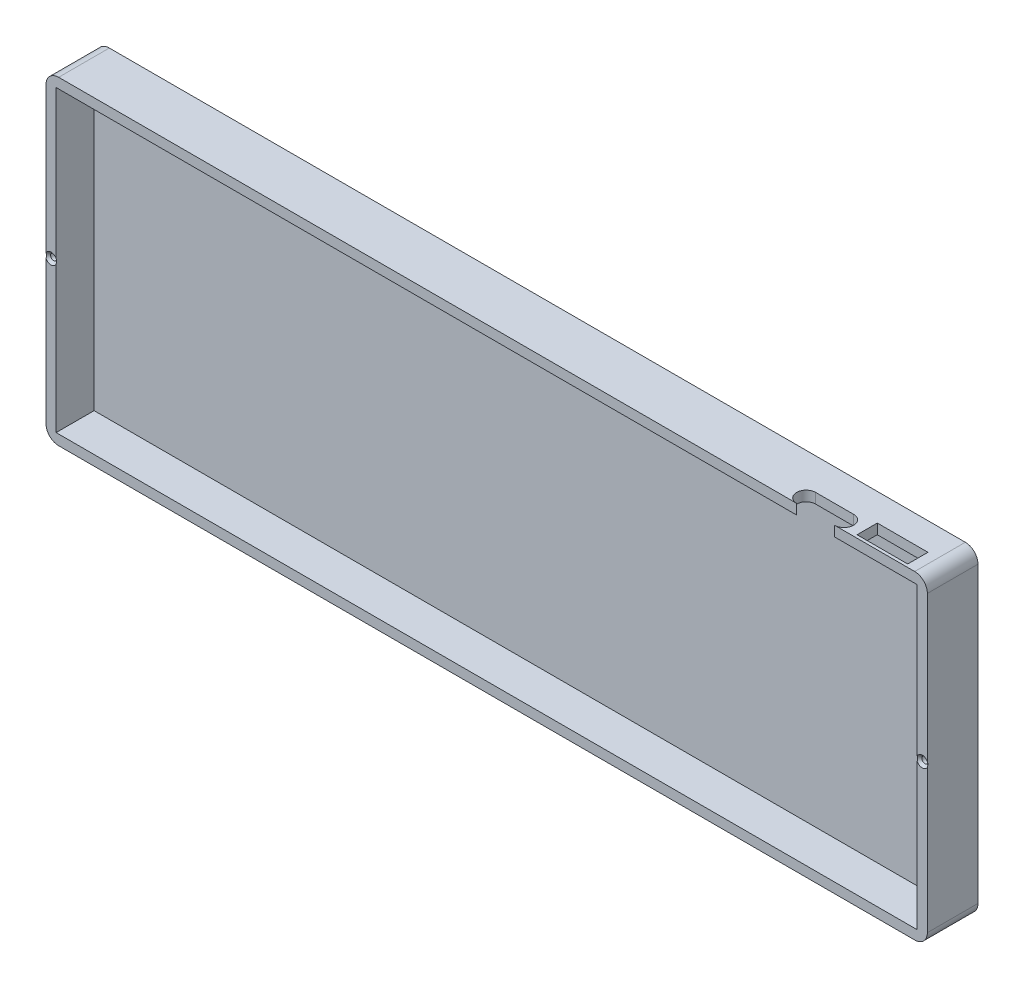
from build123d import *

# Parameters (mm, degrees)
SKETCH1_W                                       = 348
SKETCH1_H                                       = 126
BOSS_EXTRUDE1_DEPTH                             = 20
SKETCH2_W                                       = 340
SKETCH2_H                                       = 118
CUT_EXTRUDE1_DEPTH                              = 15
CUT_EXTRUDE2_REACH                              = 217.759
CUT_EXTRUDE3_REACH                              = 217.759
SKETCH5_W                                       = 20
SKETCH5_H                                       = 8
FILLET1_R                                       = 5
CSK_FOR_M2_FLAT_HEAD_MACHINE_SCREW2_D           = 2.4
CSK_FOR_M2_FLAT_HEAD_MACHINE_SCREW2_DEPTH       = 17.278967257
CSK_FOR_M2_FLAT_HEAD_MACHINE_SCREW2_CSINK_D     = 4.4
CSK_FOR_M2_FLAT_HEAD_MACHINE_SCREW2_CSINK_ANGLE = 90
CSK_FOR_M2_FLAT_HEAD_MACHINE_SCREW2_TIP         = 0.721032743


with BuildPart() as part:
    # Sketch1 → Boss-Extrude1 (new body)
    with BuildSketch(Plane.XY):
        Rectangle(SKETCH1_W, SKETCH1_H)
    extrude(amount=BOSS_EXTRUDE1_DEPTH)

    # Sketch2 → Cut-Extrude1 (cut)
    with BuildSketch(Plane.XY.offset(20)):
        Rectangle(SKETCH2_W, SKETCH2_H)
    extrude(amount=-CUT_EXTRUDE1_DEPTH, mode=Mode.SUBTRACT)

    # Sketch4 → Cut-Extrude2 (cut, up to next)
    with BuildSketch(Plane(origin=(0, 63, 0), x_dir=(1, 0, 0), z_dir=(0, 1, 0)), mode=Mode.PRIVATE) as cut_extrude2_sk1:
        with BuildLine():
            Line((122.39, -12.5), (137.39, -12.5))
            ThreePointArc((137.39, -12.5), (141.14, -16.25), (137.39, -20))
            Line((137.39, -20), (122.39, -20))
            ThreePointArc((122.39, -20), (118.64, -16.25), (122.39, -12.5))
        make_face()
    cut_extrude2_tool1 = extrude(cut_extrude2_sk1.sketch, amount=-CUT_EXTRUDE2_REACH, mode=Mode.PRIVATE) & part.part
    add(cut_extrude2_tool1.solids().sort_by_distance((129.89, 63, 16.25))[0], mode=Mode.SUBTRACT)

    # Sketch5 → Cut-Extrude3 (cut, up to next)
    with BuildSketch(Plane(origin=(0, 63, 0), x_dir=(1, 0, 0), z_dir=(0, 1, 0)), mode=Mode.PRIVATE) as cut_extrude3_sk1:
        with Locations((155.05, -14.81)):
            Rectangle(SKETCH5_W, SKETCH5_H)
    cut_extrude3_tool1 = extrude(cut_extrude3_sk1.sketch, amount=-CUT_EXTRUDE3_REACH, mode=Mode.PRIVATE) & part.part
    add(cut_extrude3_tool1.solids().sort_by_distance((155.05, 63, 14.81))[0], mode=Mode.SUBTRACT)

    # Fillet1
    fillet1_edges = [part.edges().sort_by_distance(p)[0] for p in [
        (-174, 63, 10),
        (-174, -63, 10),
        (174, -63, 10),
        (174, 63, 10),
    ]]
    fillet(fillet1_edges, radius=FILLET1_R)

    # CSK for M2 Flat Head Machine Screw2
    with Locations(Plane.XY.offset(20)):
        with Locations((-172, -0.475), (172, -0.475)):
            CounterSinkHole(CSK_FOR_M2_FLAT_HEAD_MACHINE_SCREW2_D / 2, CSK_FOR_M2_FLAT_HEAD_MACHINE_SCREW2_CSINK_D / 2, depth=CSK_FOR_M2_FLAT_HEAD_MACHINE_SCREW2_DEPTH, counter_sink_angle=CSK_FOR_M2_FLAT_HEAD_MACHINE_SCREW2_CSINK_ANGLE)
            with Locations((0, 0, -(CSK_FOR_M2_FLAT_HEAD_MACHINE_SCREW2_DEPTH + CSK_FOR_M2_FLAT_HEAD_MACHINE_SCREW2_TIP / 2))):  # 118° drill point
                Cone(0, CSK_FOR_M2_FLAT_HEAD_MACHINE_SCREW2_D / 2, CSK_FOR_M2_FLAT_HEAD_MACHINE_SCREW2_TIP, mode=Mode.SUBTRACT)


solid = part.part
